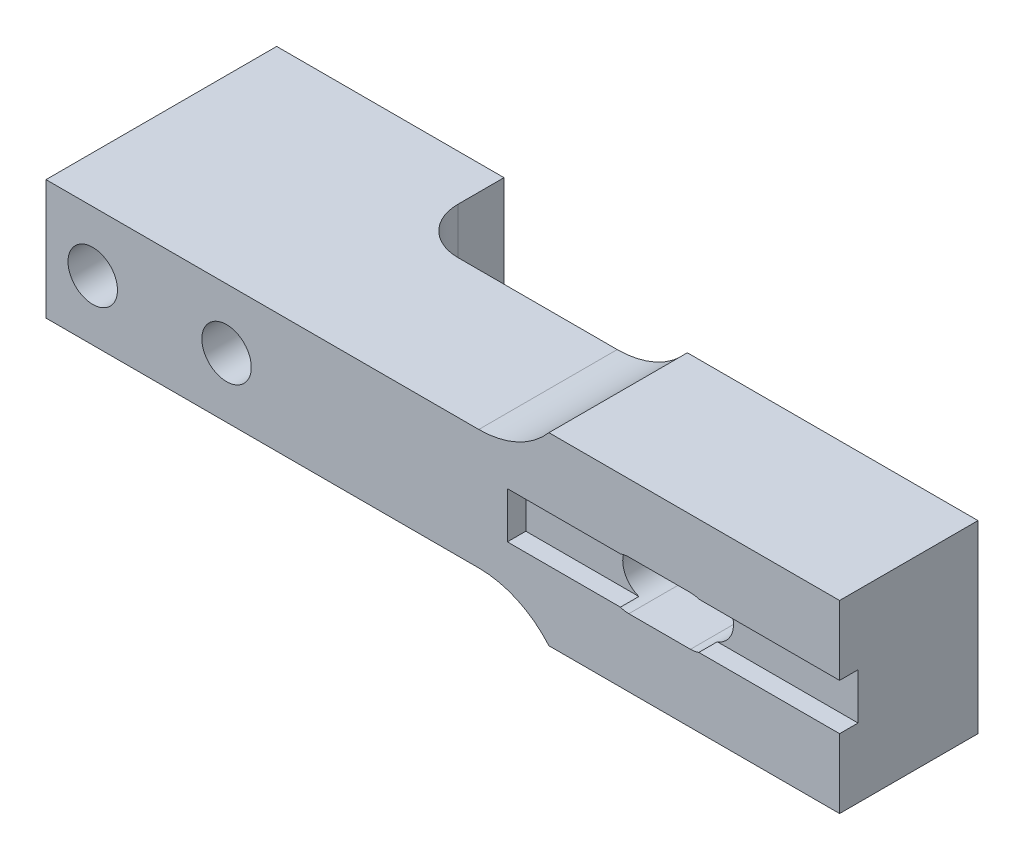
from build123d import *

# Parameters (mm, degrees)
SKETCH1_W           = 24.634
SKETCH1_H           = 13
BOSS_EXTRUDE1_DEPTH = 10
SKETCH4_W           = 82.5
SKETCH4_H           = 13
BOSS_EXTRUDE4_DEPTH = 15
SKETCH5_W           = 28
SKETCH5_H           = 3.5
BOSS_EXTRUDE5_DEPTH = 15
CUT_EXTRUDE1_DEPTH  = 88.769584709
SKETCH7_W           = 32.5
SKETCH7_H           = 5
CUT_EXTRUDE2_DEPTH  = 2
SKETCH11_R          = 2.68
CUT_EXTRUDE3_DEPTH  = 88.769584709
FILLET1_R           = 10
FILLET2_R           = 5
BOSS_EXTRUDE6_DEPTH = 3.5


with BuildPart() as part:
    # Sketch1 → Boss-Extrude1 (new body)
    with BuildSketch(Plane.XY):
        with Locations((12.317, 6.5)):
            Rectangle(SKETCH1_W, SKETCH1_H)
    extrude(amount=BOSS_EXTRUDE1_DEPTH)

    # Sketch4 → Boss-Extrude4 (add)
    with BuildSketch(Plane.XY.offset(10)):
        with Locations((41.25, 6.5)):
            Rectangle(SKETCH4_W, SKETCH4_H)
    extrude(amount=BOSS_EXTRUDE4_DEPTH)

    # Sketch5 → Boss-Extrude5 (add)
    with BuildSketch(Plane.XY.offset(25)):
        with Locations((68.5, -1.75)):
            Rectangle(SKETCH5_W, SKETCH5_H)
        with Locations((68.5, 14.75)):
            Rectangle(SKETCH5_W, SKETCH5_H)
    extrude(amount=-BOSS_EXTRUDE5_DEPTH)

    # Sketch6 → Cut-Extrude1 (cut, through all)
    with BuildSketch(Plane.XY.offset(25)):
        with BuildLine():
            Line((63.16, 9.16), (69.84, 9.16))
            ThreePointArc((69.84, 9.16), (72.5, 6.5), (69.84, 3.84))
            Line((69.84, 3.84), (63.16, 3.84))
            ThreePointArc((63.16, 3.84), (60.5, 6.5), (63.16, 9.16))
        make_face()
    extrude(amount=-CUT_EXTRUDE1_DEPTH, mode=Mode.SUBTRACT)

    # Sketch7 → Cut-Extrude2 (cut)
    with BuildSketch(Plane.XY.offset(25)):
        with Locations((66.25, 6.5)):
            Rectangle(SKETCH7_W, SKETCH7_H)
    extrude(amount=-CUT_EXTRUDE2_DEPTH, mode=Mode.SUBTRACT)

    # Sketch11 → Cut-Extrude3 (cut, through all)
    with BuildSketch(Plane(origin=(0, 0, 0), x_dir=(-1, 0, 0), z_dir=(0, 0, -1))):
        with Locations((-5.067, 6.5)):
            Circle(SKETCH11_R)
        with Locations((-19.567, 6.5)):
            Circle(SKETCH11_R)
    extrude(amount=-CUT_EXTRUDE3_DEPTH, mode=Mode.SUBTRACT)

    # Fillet1
    # the kernel refuses this fillet: 10 mm, written as the material it adds along each edge
    with BuildSketch(Plane(origin=(54.5, 13, 25), x_dir=(-1, 0, 0), z_dir=(0, 0, -1))) as fillet1_piece_1:
        with BuildLine():
            CenterArc((7.599342077, 10), FILLET1_R, 220.541601874, 49.458398126)
            Line((0, 3.5), (-0.151986842, 3.37))
            ThreePointArc((-0.151986842, 3.37), (-0.2, 1.75), (-0.2, 0))
            Line((-0.2, 0), (0, -0.2))
            Line((0, -0.2), (7.599342077, -0.2))
            Line((7.599342077, -0.2), (7.599342077, 0))
        make_face()
    extrude(amount=15)
    with BuildSketch(Plane(origin=(54.5, 0, 25), x_dir=(-1, 0, 0), z_dir=(0, 0, -1))) as fillet1_piece_2:
        with BuildLine():
            CenterArc((7.599342077, -10), FILLET1_R, 90, 49.458398126)
            Line((0, -3.5), (-0.151986842, -3.37))
            ThreePointArc((-0.151986842, -3.37), (-0.2, -1.75), (-0.2, 0))
            Line((-0.2, 0), (0, 0.2))
            Line((0, 0.2), (7.599342077, 0.2))
            Line((7.599342077, 0.2), (7.599342077, 0))
        make_face()
    extrude(amount=15)

    # Fillet2
    fillet2_edges = [part.edges().sort_by_distance(p)[0] for p in [
        (24.634, 6.5, 10),
    ]]
    fillet(fillet2_edges, radius=FILLET2_R)

    # Sketch12 → Boss-Extrude6 (add)
    with BuildSketch(Plane(origin=(82.5, 0, 0), x_dir=(0, 0, -1), z_dir=(1, 0, 0))):
        Polygon((-25, 16.5), (-25, 9), (-23, 9), (-23, 4), (-25, 4), (-25, -3.5), (-10, -3.5), (-10, 16.5), align=None)
    extrude(amount=BOSS_EXTRUDE6_DEPTH)


solid = part.part
